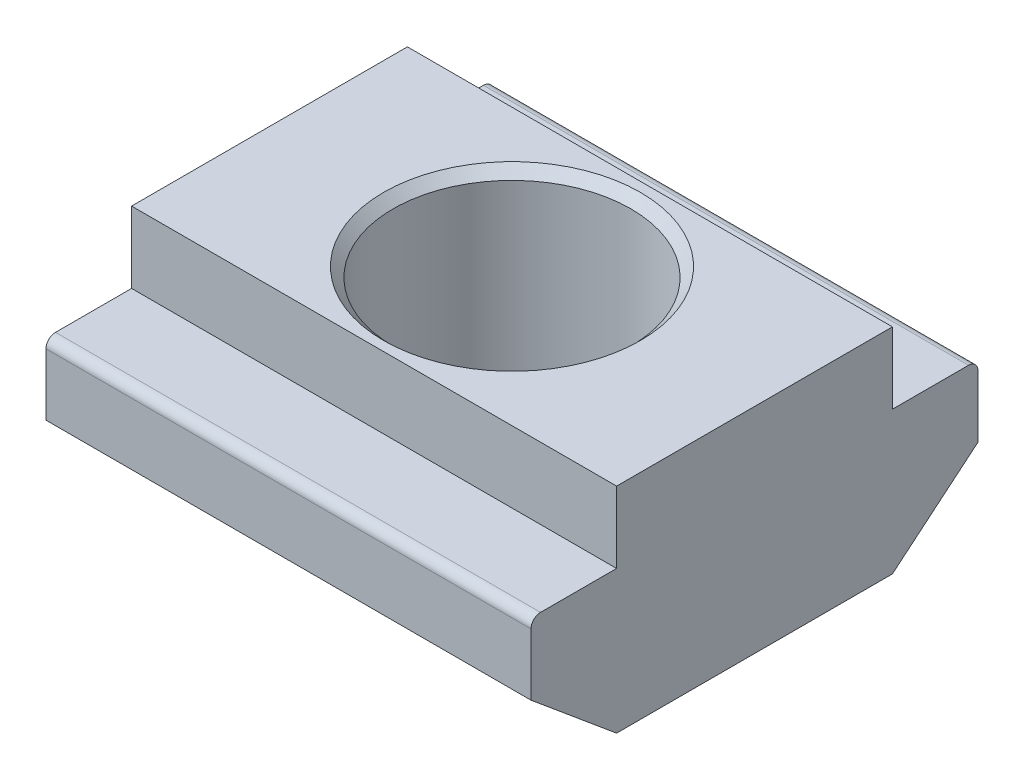
from build123d import *

# Parameters (mm, degrees)
BODY_DEPTH     = 10.2
SKETCH_2_R     = 2.5
HOLE_DEPTH     = 10.2
CHAMFER_2_SIZE = 0.2
FILLET_2_R     = 0.2


with BuildPart() as part:
    # Эскиз1 → Body (new body)
    with BuildSketch(Plane(origin=(0, 0, 0), x_dir=(0, 0, -1), z_dir=(1, 0, 0))):
        Polygon((-2.9, 0), (2.9, 0), (4.7, 1.5), (4.7, 3), (2.9, 3), (2.9, 4.5), (-2.9, 4.5), (-2.9, 3), (-4.7, 3), (-4.7, 1.5), align=None)
    extrude(amount=BODY_DEPTH)

    # Эскиз2 → Hole (cut)
    with BuildSketch(Plane(origin=(0, 4.5, 0), x_dir=(1, 0, 0), z_dir=(0, 1, 0))):
        with Locations((5.1, 0)):
            Circle(SKETCH_2_R)
    extrude(amount=-HOLE_DEPTH, mode=Mode.SUBTRACT)

    # Chamfer 2
    chamfer_2_edges = [part.edges().sort_by_distance(p)[0] for p in [
        (2.6, 4.5, 0),
    ]]
    chamfer(chamfer_2_edges, length=CHAMFER_2_SIZE)

    # Fillet 2
    fillet_2_edges = [part.edges().sort_by_distance(p)[0] for p in [
        (5.1, 3, 4.7),
        (5.1, 3, -4.7),
    ]]
    fillet(fillet_2_edges, radius=FILLET_2_R)


solid = part.part
